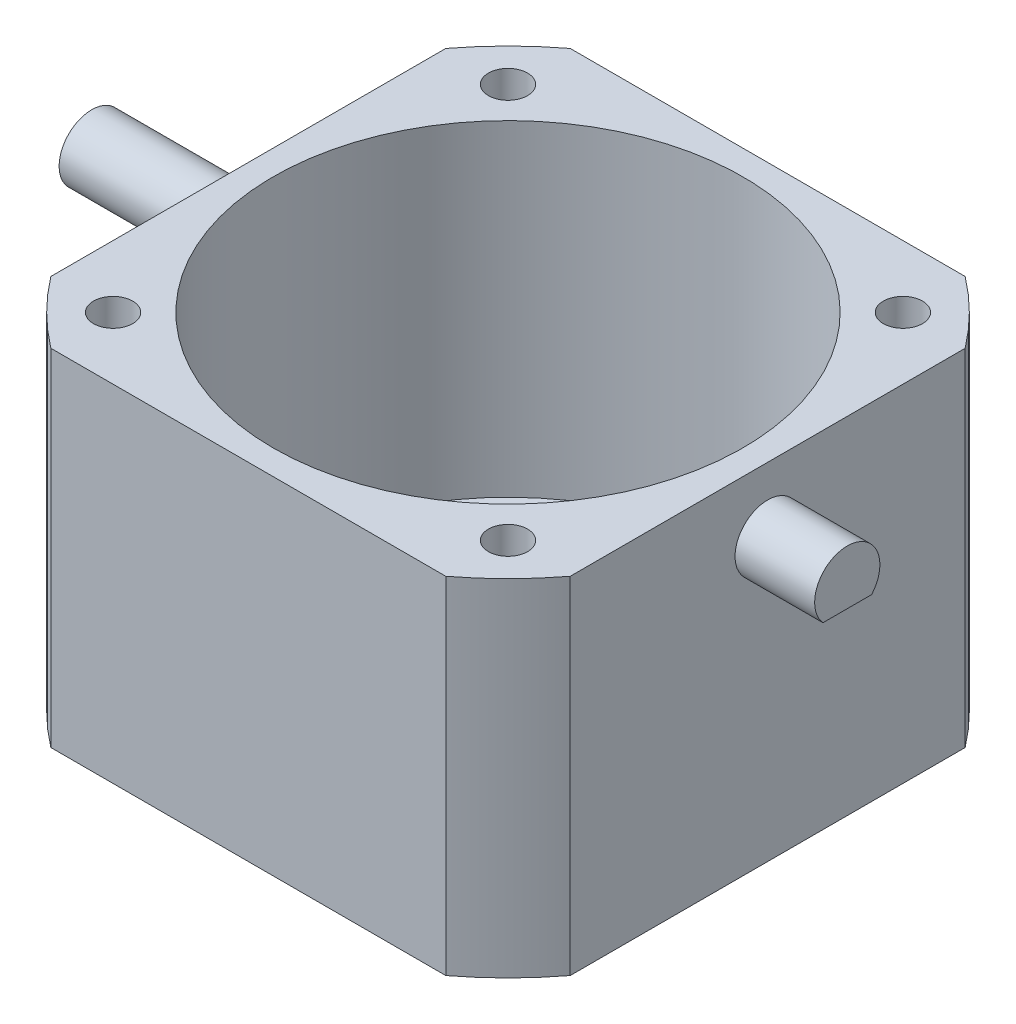
from build123d import *

# Parameters (mm, degrees)
SKETCH1_W                = 39.8
SKETCH1_H                = 39.8
BOSS_EXTRUDE1_DEPTH      = 40
CUT_EXTRUDE1_DEPTH       = 25
SKETCH3_R                = 6.5
CUT_EXTRUDE2_DEPTH       = 4.5
CUT_EXTRUDE3_DEPTH       = 64.547856
CUT_EXTRUDE3_DEPTH_BACK  = 64.547856
SKETCH4_R                = 1.585
CUT_EXTRUDE4_DEPTH       = 62.587986
CUT_EXTRUDE4_DEPTH_BACK  = 62.587986
SKETCH5_R                = 1.5
SKETCH6_R                = 2.5
BOSS_EXTRUDE2_DEPTH      = 12
BOSS_EXTRUDE3_START      = 5.1
SKETCH7_R                = 2.5
BOSS_EXTRUDE3_DEPTH      = 5.1
CUT_EXTRUDE5_DEPTH       = 73.111372
CUT_EXTRUDE6_DEPTH       = 73.111372
BOSS_EXTRUDE4_START      = 1
SKETCH10_R               = 2.5
BOSS_EXTRUDE4_DEPTH      = 1
SKETCH11_R               = 6.5
CUT_EXTRUDE7_DEPTH       = 68.535916
CUT_EXTRUDE8_START       = -12
CUT_EXTRUDE8_DEPTH       = 12
CUT_EXTRUDE9_START       = -3
SKETCH13_R               = 1.5
CUT_EXTRUDE9_DEPTH       = 3
BOSS_EXTRUDE5_DEPTH      = 1
CUT_EXTRUDE10_DEPTH      = 67.89432
CUT_EXTRUDE10_DEPTH_BACK = 67.89432
SKETCH15_R               = 1.5
CUT_EXTRUDE11_START      = -4
CUT_EXTRUDE11_DEPTH      = 4
CUT_EXTRUDE12_START      = -1
CUT_EXTRUDE12_DEPTH      = 1
BOSS_EXTRUDE6_DEPTH      = 3
BOSS_EXTRUDE7_START      = -3
BOSS_EXTRUDE7_OUTLINE_R  = 7
BOSS_EXTRUDE7_DEPTH      = 3
SKETCH20_R               = 1.5
CUT_EXTRUDE13_DEPTH      = 67.89432
CUT_EXTRUDE14_START      = -3
CUT_EXTRUDE14_DEPTH      = 3
CUT_EXTRUDE16_START      = -1.5
SKETCH22_R               = 17
SKETCH22_R_2             = 1.5
CUT_EXTRUDE16_DEPTH      = 1.5


# Read off the part's stored shape, not the designer's step: Cut-Extrude11, Boss-Extrude7, Cut-Extrude14
with BuildPart() as part:
    # Sketch1 → Boss-Extrude1 (new body)
    with BuildSketch(Plane(origin=(0, 0, 0), x_dir=(1, 0, 0), z_dir=(0, 1, 0))):
        with Locations((19.9, 19.9)):
            Rectangle(SKETCH1_W, SKETCH1_H)
    extrude(amount=BOSS_EXTRUDE1_DEPTH)

    # Sketch2 → Cut-Extrude1 (cut)
    with BuildSketch(Plane(origin=(0, 40, 0), x_dir=(1, 0, 0), z_dir=(0, 1, 0))):
        with BuildLine():
            ThreePointArc((37.9, 19.9), (32.627922, 32.627922), (19.9, 37.9))
            Line((19.9, 37.9), (19.9, 19.9))
            Line((19.9, 19.9), (37.9, 19.9))
        make_face()
        with BuildLine():
            Line((19.9, 19.9), (19.9, 37.9))
            ThreePointArc((19.9, 37.9), (7.172078, 32.627922), (1.9, 19.9))
            Line((1.9, 19.9), (19.9, 19.9))
        make_face()
        with BuildLine():
            Line((37.9, 19.9), (19.9, 19.9))
            Line((19.9, 19.9), (19.9, 1.9))
            ThreePointArc((19.9, 1.9), (32.627922, 7.172078), (37.9, 19.9))
        make_face()
        with BuildLine():
            Line((19.9, 1.9), (19.9, 19.9))
            Line((19.9, 19.9), (1.9, 19.9))
            ThreePointArc((1.9, 19.9), (7.172078, 7.172078), (19.9, 1.9))
        make_face()
        with BuildLine():
            ThreePointArc((37.9, 19.9), (32.627922, 32.627922), (19.9, 37.9))
            Line((19.9, 37.9), (19.9, 19.9))
            Line((19.9, 19.9), (37.9, 19.9))
        make_face()
        with BuildLine():
            Line((19.9, 19.9), (19.9, 37.9))
            ThreePointArc((19.9, 37.9), (7.172078, 32.627922), (1.9, 19.9))
            Line((1.9, 19.9), (19.9, 19.9))
        make_face()
        with BuildLine():
            Line((37.9, 19.9), (19.9, 19.9))
            Line((19.9, 19.9), (19.9, 1.9))
            ThreePointArc((19.9, 1.9), (32.627922, 7.172078), (37.9, 19.9))
        make_face()
        with BuildLine():
            Line((19.9, 1.9), (19.9, 19.9))
            Line((19.9, 19.9), (1.9, 19.9))
            ThreePointArc((1.9, 19.9), (7.172078, 7.172078), (19.9, 1.9))
        make_face()
        with BuildLine():
            ThreePointArc((37.9, 19.9), (32.627922, 32.627922), (19.9, 37.9))
            Line((19.9, 37.9), (19.9, 19.9))
            Line((19.9, 19.9), (37.9, 19.9))
        make_face()
        with BuildLine():
            Line((19.9, 19.9), (19.9, 37.9))
            ThreePointArc((19.9, 37.9), (7.172078, 32.627922), (1.9, 19.9))
            Line((1.9, 19.9), (19.9, 19.9))
        make_face()
        with BuildLine():
            Line((37.9, 19.9), (19.9, 19.9))
            Line((19.9, 19.9), (19.9, 1.9))
            ThreePointArc((19.9, 1.9), (32.627922, 7.172078), (37.9, 19.9))
        make_face()
        with BuildLine():
            Line((19.9, 1.9), (19.9, 19.9))
            Line((19.9, 19.9), (1.9, 19.9))
            ThreePointArc((1.9, 19.9), (7.172078, 7.172078), (19.9, 1.9))
        make_face()
        with BuildLine():
            ThreePointArc((37.9, 19.9), (32.627922, 32.627922), (19.9, 37.9))
            Line((19.9, 37.9), (19.9, 19.9))
            Line((19.9, 19.9), (37.9, 19.9))
        make_face()
        with BuildLine():
            Line((19.9, 19.9), (19.9, 37.9))
            ThreePointArc((19.9, 37.9), (7.172078, 32.627922), (1.9, 19.9))
            Line((1.9, 19.9), (19.9, 19.9))
        make_face()
        with BuildLine():
            Line((37.9, 19.9), (19.9, 19.9))
            Line((19.9, 19.9), (19.9, 1.9))
            ThreePointArc((19.9, 1.9), (32.627922, 7.172078), (37.9, 19.9))
        make_face()
        with BuildLine():
            Line((19.9, 1.9), (19.9, 19.9))
            Line((19.9, 19.9), (1.9, 19.9))
            ThreePointArc((1.9, 19.9), (7.172078, 7.172078), (19.9, 1.9))
        make_face()
    extrude(amount=-CUT_EXTRUDE1_DEPTH, mode=Mode.SUBTRACT)

    # Sketch3 → Cut-Extrude2 (cut)
    with BuildSketch(Plane(origin=(0, 15, 0), x_dir=(1, 0, 0), z_dir=(0, 1, 0))):
        with Locations(Location((19.9, 19.9, 0), (0, 0, 270))):
            Circle(SKETCH3_R)
    extrude(amount=-CUT_EXTRUDE2_DEPTH, mode=Mode.SUBTRACT)

    # Sketch4 → Cut-Extrude3 (cut, two sides: drawn at the far end of the back side and taken through both)
    with BuildSketch(Plane(origin=(0, 10.5, 0), x_dir=(1, 0, 0), z_dir=(0, 1, 0)).offset(-CUT_EXTRUDE3_DEPTH_BACK)):
        with Locations(Location((19.9, 19.9, 0), (0, 0, 270))):
            Circle(SKETCH4_R)
    extrude(amount=CUT_EXTRUDE3_DEPTH + CUT_EXTRUDE3_DEPTH_BACK, mode=Mode.SUBTRACT)

    # Sketch5 → Cut-Extrude4 (cut, two sides: drawn at the far end of the back side and taken through both)
    with BuildSketch(Plane(origin=(0, 15, 0), x_dir=(1, 0, 0), z_dir=(0, 1, 0)).offset(-CUT_EXTRUDE4_DEPTH_BACK)):
        with Locations(Location((7.4, 19.9, 0), (0, 0, 270))):
            Circle(SKETCH5_R)
        with Locations(Location((32.4, 19.9, 0), (0, 0, 270))):
            Circle(SKETCH5_R)
        with Locations(Location((19.9, 7.4, 0), (0, 0, 270))):
            Circle(SKETCH5_R)
        with Locations(Location((19.9, 32.4, 0), (0, 0, 270))):
            Circle(SKETCH5_R)
    extrude(amount=CUT_EXTRUDE4_DEPTH + CUT_EXTRUDE4_DEPTH_BACK, mode=Mode.SUBTRACT)

    # Sketch6 → Boss-Extrude2 (add)
    with BuildSketch(Plane.ZY):
        with Locations(Location((-19.9, 35, 0), (0, 0, 180))):
            Circle(SKETCH6_R)
    extrude(amount=BOSS_EXTRUDE2_DEPTH)

    # Sketch7 → Boss-Extrude3 (add)
    with BuildSketch(Plane(origin=(39.8, 0, 0), x_dir=(0, 0, -1), z_dir=(1, 0, 0)).offset(BOSS_EXTRUDE3_START)):
        with Locations((19.9, 35)):
            Circle(SKETCH7_R)
    extrude(amount=-BOSS_EXTRUDE3_DEPTH)

    # Sketch8 → Cut-Extrude5 (cut, through all)
    with BuildSketch(Plane(origin=(0, 40, 0), x_dir=(1, 0, 0), z_dir=(0, 1, 0))):
        with BuildLine():
            Line((39.8, 39.8), (35.032416, 39.8))
            ThreePointArc((35.032416, 39.8), (37.57767, 37.57767), (39.8, 35.032416))
            Line((39.8, 35.032416), (39.8, 39.8))
        make_face()
        with BuildLine():
            Line((4.767584, 39.8), (0, 39.8))
            Line((0, 39.8), (0, 35.032416))
            ThreePointArc((0, 35.032416), (2.22233, 37.57767), (4.767584, 39.8))
        make_face()
        with BuildLine():
            ThreePointArc((4.767584, 0), (2.22233, 2.22233), (0, 4.767584))
            Line((0, 4.767584), (0, 0))
            Line((0, 0), (4.767584, 0))
        make_face()
        with BuildLine():
            Line((39.8, 0), (39.8, 4.767584))
            ThreePointArc((39.8, 4.767584), (37.57767, 2.22233), (35.032416, 0))
            Line((35.032416, 0), (39.8, 0))
        make_face()
    extrude(amount=-CUT_EXTRUDE5_DEPTH, mode=Mode.SUBTRACT)

    # Sketch9 → Cut-Extrude6 (cut, through all)
    with BuildSketch(Plane(origin=(0, 40, 0), x_dir=(1, 0, 0), z_dir=(0, 1, 0))):
        with BuildLine():
            ThreePointArc((35.032416, 6.267584), (33.971755, 5.828245), (33.532416, 4.767584))
            Line((33.532416, 4.767584), (35.032416, 4.767584))
            Line((35.032416, 4.767584), (35.032416, 6.267584))
        make_face()
        with BuildLine():
            Line((35.032416, 4.767584), (33.532416, 4.767584))
            ThreePointArc((33.532416, 4.767584), (33.971755, 3.706924), (35.032416, 3.267584))
            Line((35.032416, 3.267584), (35.032416, 4.767584))
        make_face()
        with BuildLine():
            Line((35.032416, 6.267584), (35.032416, 4.767584))
            Line((35.032416, 4.767584), (36.532416, 4.767584))
            ThreePointArc((36.532416, 4.767584), (36.093076, 5.828245), (35.032416, 6.267584))
        make_face()
        with BuildLine():
            Line((36.532416, 4.767584), (35.032416, 4.767584))
            Line((35.032416, 4.767584), (35.032416, 3.267584))
            ThreePointArc((35.032416, 3.267584), (36.093076, 3.706924), (36.532416, 4.767584))
        make_face()
        with BuildLine():
            ThreePointArc((35.032416, 6.267584), (33.971755, 5.828245), (33.532416, 4.767584))
            Line((33.532416, 4.767584), (35.032416, 4.767584))
            Line((35.032416, 4.767584), (35.032416, 6.267584))
        make_face()
        with BuildLine():
            Line((35.032416, 4.767584), (33.532416, 4.767584))
            ThreePointArc((33.532416, 4.767584), (33.971755, 3.706924), (35.032416, 3.267584))
            Line((35.032416, 3.267584), (35.032416, 4.767584))
        make_face()
        with BuildLine():
            Line((35.032416, 6.267584), (35.032416, 4.767584))
            Line((35.032416, 4.767584), (36.532416, 4.767584))
            ThreePointArc((36.532416, 4.767584), (36.093076, 5.828245), (35.032416, 6.267584))
        make_face()
        with BuildLine():
            Line((36.532416, 4.767584), (35.032416, 4.767584))
            Line((35.032416, 4.767584), (35.032416, 3.267584))
            ThreePointArc((35.032416, 3.267584), (36.093076, 3.706924), (36.532416, 4.767584))
        make_face()
        with BuildLine():
            ThreePointArc((35.032416, 6.267584), (33.971755, 5.828245), (33.532416, 4.767584))
            Line((33.532416, 4.767584), (35.032416, 4.767584))
            Line((35.032416, 4.767584), (35.032416, 6.267584))
        make_face()
        with BuildLine():
            Line((35.032416, 4.767584), (33.532416, 4.767584))
            ThreePointArc((33.532416, 4.767584), (33.971755, 3.706924), (35.032416, 3.267584))
            Line((35.032416, 3.267584), (35.032416, 4.767584))
        make_face()
        with BuildLine():
            Line((35.032416, 6.267584), (35.032416, 4.767584))
            Line((35.032416, 4.767584), (36.532416, 4.767584))
            ThreePointArc((36.532416, 4.767584), (36.093076, 5.828245), (35.032416, 6.267584))
        make_face()
        with BuildLine():
            Line((36.532416, 4.767584), (35.032416, 4.767584))
            Line((35.032416, 4.767584), (35.032416, 3.267584))
            ThreePointArc((35.032416, 3.267584), (36.093076, 3.706924), (36.532416, 4.767584))
        make_face()
        with BuildLine():
            ThreePointArc((35.032416, 6.267584), (33.971755, 5.828245), (33.532416, 4.767584))
            Line((33.532416, 4.767584), (35.032416, 4.767584))
            Line((35.032416, 4.767584), (35.032416, 6.267584))
        make_face()
        with BuildLine():
            Line((35.032416, 4.767584), (33.532416, 4.767584))
            ThreePointArc((33.532416, 4.767584), (33.971755, 3.706924), (35.032416, 3.267584))
            Line((35.032416, 3.267584), (35.032416, 4.767584))
        make_face()
        with BuildLine():
            Line((35.032416, 6.267584), (35.032416, 4.767584))
            Line((35.032416, 4.767584), (36.532416, 4.767584))
            ThreePointArc((36.532416, 4.767584), (36.093076, 5.828245), (35.032416, 6.267584))
        make_face()
        with BuildLine():
            Line((36.532416, 4.767584), (35.032416, 4.767584))
            Line((35.032416, 4.767584), (35.032416, 3.267584))
            ThreePointArc((35.032416, 3.267584), (36.093076, 3.706924), (36.532416, 4.767584))
        make_face()
        with BuildLine():
            ThreePointArc((4.767584, 6.267584), (3.706924, 5.828245), (3.267584, 4.767584))
            Line((3.267584, 4.767584), (4.767584, 4.767584))
            Line((4.767584, 4.767584), (4.767584, 6.267584))
        make_face()
        with BuildLine():
            Line((4.767584, 4.767584), (3.267584, 4.767584))
            ThreePointArc((3.267584, 4.767584), (3.706924, 3.706924), (4.767584, 3.267584))
            Line((4.767584, 3.267584), (4.767584, 4.767584))
        make_face()
        with BuildLine():
            Line((4.767584, 6.267584), (4.767584, 4.767584))
            Line((4.767584, 4.767584), (6.267584, 4.767584))
            ThreePointArc((6.267584, 4.767584), (5.828245, 5.828245), (4.767584, 6.267584))
        make_face()
        with BuildLine():
            Line((6.267584, 4.767584), (4.767584, 4.767584))
            Line((4.767584, 4.767584), (4.767584, 3.267584))
            ThreePointArc((4.767584, 3.267584), (5.828245, 3.706924), (6.267584, 4.767584))
        make_face()
        with BuildLine():
            ThreePointArc((4.767584, 6.267584), (3.706924, 5.828245), (3.267584, 4.767584))
            Line((3.267584, 4.767584), (4.767584, 4.767584))
            Line((4.767584, 4.767584), (4.767584, 6.267584))
        make_face()
        with BuildLine():
            Line((4.767584, 4.767584), (3.267584, 4.767584))
            ThreePointArc((3.267584, 4.767584), (3.706924, 3.706924), (4.767584, 3.267584))
            Line((4.767584, 3.267584), (4.767584, 4.767584))
        make_face()
        with BuildLine():
            Line((4.767584, 6.267584), (4.767584, 4.767584))
            Line((4.767584, 4.767584), (6.267584, 4.767584))
            ThreePointArc((6.267584, 4.767584), (5.828245, 5.828245), (4.767584, 6.267584))
        make_face()
        with BuildLine():
            Line((6.267584, 4.767584), (4.767584, 4.767584))
            Line((4.767584, 4.767584), (4.767584, 3.267584))
            ThreePointArc((4.767584, 3.267584), (5.828245, 3.706924), (6.267584, 4.767584))
        make_face()
        with BuildLine():
            ThreePointArc((4.767584, 6.267584), (3.706924, 5.828245), (3.267584, 4.767584))
            Line((3.267584, 4.767584), (4.767584, 4.767584))
            Line((4.767584, 4.767584), (4.767584, 6.267584))
        make_face()
        with BuildLine():
            Line((4.767584, 4.767584), (3.267584, 4.767584))
            ThreePointArc((3.267584, 4.767584), (3.706924, 3.706924), (4.767584, 3.267584))
            Line((4.767584, 3.267584), (4.767584, 4.767584))
        make_face()
        with BuildLine():
            Line((4.767584, 6.267584), (4.767584, 4.767584))
            Line((4.767584, 4.767584), (6.267584, 4.767584))
            ThreePointArc((6.267584, 4.767584), (5.828245, 5.828245), (4.767584, 6.267584))
        make_face()
        with BuildLine():
            Line((6.267584, 4.767584), (4.767584, 4.767584))
            Line((4.767584, 4.767584), (4.767584, 3.267584))
            ThreePointArc((4.767584, 3.267584), (5.828245, 3.706924), (6.267584, 4.767584))
        make_face()
        with BuildLine():
            ThreePointArc((4.767584, 6.267584), (3.706924, 5.828245), (3.267584, 4.767584))
            Line((3.267584, 4.767584), (4.767584, 4.767584))
            Line((4.767584, 4.767584), (4.767584, 6.267584))
        make_face()
        with BuildLine():
            Line((4.767584, 4.767584), (3.267584, 4.767584))
            ThreePointArc((3.267584, 4.767584), (3.706924, 3.706924), (4.767584, 3.267584))
            Line((4.767584, 3.267584), (4.767584, 4.767584))
        make_face()
        with BuildLine():
            Line((4.767584, 6.267584), (4.767584, 4.767584))
            Line((4.767584, 4.767584), (6.267584, 4.767584))
            ThreePointArc((6.267584, 4.767584), (5.828245, 5.828245), (4.767584, 6.267584))
        make_face()
        with BuildLine():
            Line((6.267584, 4.767584), (4.767584, 4.767584))
            Line((4.767584, 4.767584), (4.767584, 3.267584))
            ThreePointArc((4.767584, 3.267584), (5.828245, 3.706924), (6.267584, 4.767584))
        make_face()
        with BuildLine():
            ThreePointArc((3.267584, 35.032416), (3.706924, 33.971755), (4.767584, 33.532416))
            Line((4.767584, 33.532416), (4.767584, 35.032416))
            Line((4.767584, 35.032416), (3.267584, 35.032416))
        make_face()
        with BuildLine():
            Line((4.767584, 35.032416), (4.767584, 33.532416))
            ThreePointArc((4.767584, 33.532416), (5.828245, 33.971755), (6.267584, 35.032416))
            Line((6.267584, 35.032416), (4.767584, 35.032416))
        make_face()
        with BuildLine():
            Line((3.267584, 35.032416), (4.767584, 35.032416))
            Line((4.767584, 35.032416), (4.767584, 36.532416))
            ThreePointArc((4.767584, 36.532416), (3.706924, 36.093076), (3.267584, 35.032416))
        make_face()
        with BuildLine():
            Line((4.767584, 36.532416), (4.767584, 35.032416))
            Line((4.767584, 35.032416), (6.267584, 35.032416))
            ThreePointArc((6.267584, 35.032416), (5.828245, 36.093076), (4.767584, 36.532416))
        make_face()
        with BuildLine():
            ThreePointArc((3.267584, 35.032416), (3.706924, 33.971755), (4.767584, 33.532416))
            Line((4.767584, 33.532416), (4.767584, 35.032416))
            Line((4.767584, 35.032416), (3.267584, 35.032416))
        make_face()
        with BuildLine():
            Line((4.767584, 35.032416), (4.767584, 33.532416))
            ThreePointArc((4.767584, 33.532416), (5.828245, 33.971755), (6.267584, 35.032416))
            Line((6.267584, 35.032416), (4.767584, 35.032416))
        make_face()
        with BuildLine():
            Line((3.267584, 35.032416), (4.767584, 35.032416))
            Line((4.767584, 35.032416), (4.767584, 36.532416))
            ThreePointArc((4.767584, 36.532416), (3.706924, 36.093076), (3.267584, 35.032416))
        make_face()
        with BuildLine():
            Line((4.767584, 36.532416), (4.767584, 35.032416))
            Line((4.767584, 35.032416), (6.267584, 35.032416))
            ThreePointArc((6.267584, 35.032416), (5.828245, 36.093076), (4.767584, 36.532416))
        make_face()
        with BuildLine():
            ThreePointArc((3.267584, 35.032416), (3.706924, 33.971755), (4.767584, 33.532416))
            Line((4.767584, 33.532416), (4.767584, 35.032416))
            Line((4.767584, 35.032416), (3.267584, 35.032416))
        make_face()
        with BuildLine():
            Line((4.767584, 35.032416), (4.767584, 33.532416))
            ThreePointArc((4.767584, 33.532416), (5.828245, 33.971755), (6.267584, 35.032416))
            Line((6.267584, 35.032416), (4.767584, 35.032416))
        make_face()
        with BuildLine():
            Line((3.267584, 35.032416), (4.767584, 35.032416))
            Line((4.767584, 35.032416), (4.767584, 36.532416))
            ThreePointArc((4.767584, 36.532416), (3.706924, 36.093076), (3.267584, 35.032416))
        make_face()
        with BuildLine():
            Line((4.767584, 36.532416), (4.767584, 35.032416))
            Line((4.767584, 35.032416), (6.267584, 35.032416))
            ThreePointArc((6.267584, 35.032416), (5.828245, 36.093076), (4.767584, 36.532416))
        make_face()
        with BuildLine():
            ThreePointArc((3.267584, 35.032416), (3.706924, 33.971755), (4.767584, 33.532416))
            Line((4.767584, 33.532416), (4.767584, 35.032416))
            Line((4.767584, 35.032416), (3.267584, 35.032416))
        make_face()
        with BuildLine():
            Line((4.767584, 35.032416), (4.767584, 33.532416))
            ThreePointArc((4.767584, 33.532416), (5.828245, 33.971755), (6.267584, 35.032416))
            Line((6.267584, 35.032416), (4.767584, 35.032416))
        make_face()
        with BuildLine():
            Line((3.267584, 35.032416), (4.767584, 35.032416))
            Line((4.767584, 35.032416), (4.767584, 36.532416))
            ThreePointArc((4.767584, 36.532416), (3.706924, 36.093076), (3.267584, 35.032416))
        make_face()
        with BuildLine():
            Line((4.767584, 36.532416), (4.767584, 35.032416))
            Line((4.767584, 35.032416), (6.267584, 35.032416))
            ThreePointArc((6.267584, 35.032416), (5.828245, 36.093076), (4.767584, 36.532416))
        make_face()
        with BuildLine():
            ThreePointArc((35.032416, 36.532416), (33.971755, 36.093076), (33.532416, 35.032416))
            Line((33.532416, 35.032416), (35.032416, 35.032416))
            Line((35.032416, 35.032416), (35.032416, 36.532416))
        make_face()
        with BuildLine():
            Line((35.032416, 35.032416), (33.532416, 35.032416))
            ThreePointArc((33.532416, 35.032416), (33.971755, 33.971755), (35.032416, 33.532416))
            Line((35.032416, 33.532416), (35.032416, 35.032416))
        make_face()
        with BuildLine():
            Line((35.032416, 35.032416), (35.032416, 33.532416))
            ThreePointArc((35.032416, 33.532416), (36.093076, 33.971755), (36.532416, 35.032416))
            Line((36.532416, 35.032416), (35.032416, 35.032416))
        make_face()
        with BuildLine():
            Line((35.032416, 36.532416), (35.032416, 35.032416))
            Line((35.032416, 35.032416), (36.532416, 35.032416))
            ThreePointArc((36.532416, 35.032416), (36.093076, 36.093076), (35.032416, 36.532416))
        make_face()
        with BuildLine():
            ThreePointArc((35.032416, 36.532416), (33.971755, 36.093076), (33.532416, 35.032416))
            Line((33.532416, 35.032416), (35.032416, 35.032416))
            Line((35.032416, 35.032416), (35.032416, 36.532416))
        make_face()
        with BuildLine():
            Line((35.032416, 35.032416), (33.532416, 35.032416))
            ThreePointArc((33.532416, 35.032416), (33.971755, 33.971755), (35.032416, 33.532416))
            Line((35.032416, 33.532416), (35.032416, 35.032416))
        make_face()
        with BuildLine():
            Line((35.032416, 35.032416), (35.032416, 33.532416))
            ThreePointArc((35.032416, 33.532416), (36.093076, 33.971755), (36.532416, 35.032416))
            Line((36.532416, 35.032416), (35.032416, 35.032416))
        make_face()
        with BuildLine():
            Line((35.032416, 36.532416), (35.032416, 35.032416))
            Line((35.032416, 35.032416), (36.532416, 35.032416))
            ThreePointArc((36.532416, 35.032416), (36.093076, 36.093076), (35.032416, 36.532416))
        make_face()
        with BuildLine():
            ThreePointArc((35.032416, 36.532416), (33.971755, 36.093076), (33.532416, 35.032416))
            Line((33.532416, 35.032416), (35.032416, 35.032416))
            Line((35.032416, 35.032416), (35.032416, 36.532416))
        make_face()
        with BuildLine():
            Line((35.032416, 35.032416), (33.532416, 35.032416))
            ThreePointArc((33.532416, 35.032416), (33.971755, 33.971755), (35.032416, 33.532416))
            Line((35.032416, 33.532416), (35.032416, 35.032416))
        make_face()
        with BuildLine():
            Line((35.032416, 35.032416), (35.032416, 33.532416))
            ThreePointArc((35.032416, 33.532416), (36.093076, 33.971755), (36.532416, 35.032416))
            Line((36.532416, 35.032416), (35.032416, 35.032416))
        make_face()
        with BuildLine():
            Line((35.032416, 36.532416), (35.032416, 35.032416))
            Line((35.032416, 35.032416), (36.532416, 35.032416))
            ThreePointArc((36.532416, 35.032416), (36.093076, 36.093076), (35.032416, 36.532416))
        make_face()
        with BuildLine():
            ThreePointArc((35.032416, 36.532416), (33.971755, 36.093076), (33.532416, 35.032416))
            Line((33.532416, 35.032416), (35.032416, 35.032416))
            Line((35.032416, 35.032416), (35.032416, 36.532416))
        make_face()
        with BuildLine():
            Line((35.032416, 35.032416), (33.532416, 35.032416))
            ThreePointArc((33.532416, 35.032416), (33.971755, 33.971755), (35.032416, 33.532416))
            Line((35.032416, 33.532416), (35.032416, 35.032416))
        make_face()
        with BuildLine():
            Line((35.032416, 35.032416), (35.032416, 33.532416))
            ThreePointArc((35.032416, 33.532416), (36.093076, 33.971755), (36.532416, 35.032416))
            Line((36.532416, 35.032416), (35.032416, 35.032416))
        make_face()
        with BuildLine():
            Line((35.032416, 36.532416), (35.032416, 35.032416))
            Line((35.032416, 35.032416), (36.532416, 35.032416))
            ThreePointArc((36.532416, 35.032416), (36.093076, 36.093076), (35.032416, 36.532416))
        make_face()
    extrude(amount=-CUT_EXTRUDE6_DEPTH, mode=Mode.SUBTRACT)

    # Sketch10 → Boss-Extrude4 (add)
    with BuildSketch(Plane(origin=(44.9, 0, 0), x_dir=(0, 0, -1), z_dir=(1, 0, 0)).offset(BOSS_EXTRUDE4_START)):
        with Locations((19.9, 35)):
            Circle(SKETCH10_R)
    extrude(amount=-BOSS_EXTRUDE4_DEPTH)

    # Sketch11 → Cut-Extrude7 (cut, through all)
    with BuildSketch(Plane(origin=(0, 10.5, 0), x_dir=(1, 0, 0), z_dir=(0, 1, 0))):
        with Locations(Location((19.9, 19.9, 0), (0, 0, 270))):
            Circle(SKETCH11_R)
    extrude(amount=-CUT_EXTRUDE7_DEPTH, mode=Mode.SUBTRACT)

    # Sketch12 → Cut-Extrude8 (cut)
    with BuildSketch(Plane.XZ.offset(CUT_EXTRUDE8_START)):
        with BuildLine():
            Line((0, -4.767584), (0, -35.032416))
            ThreePointArc((0, -35.032416), (2.22233, -37.57767), (4.767584, -39.8))
            Line((4.767584, -39.8), (35.032416, -39.8))
            ThreePointArc((35.032416, -39.8), (37.57767, -37.57767), (39.8, -35.032416))
            Line((39.8, -35.032416), (39.8, -4.767584))
            ThreePointArc((39.8, -4.767584), (37.57767, -2.22233), (35.032416, 0))
            Line((35.032416, 0), (4.767584, 0))
            ThreePointArc((4.767584, 0), (2.22233, -2.22233), (0, -4.767584))
        make_face()
    extrude(amount=CUT_EXTRUDE8_DEPTH, mode=Mode.SUBTRACT)

    # Sketch13 → Cut-Extrude9 (cut)
    # profile 1 of 2: a face of its own
    with BuildSketch(Plane.XZ.offset(-12).offset(CUT_EXTRUDE9_START)):
        with BuildLine():
            ThreePointArc((19.9, -26.4), (24.142641, -28.157359), (25.9, -32.4))
            Line((25.9, -32.4), (25.9, -39.8))
            Line((25.9, -39.8), (35.032416, -39.8))
            ThreePointArc((35.032416, -39.8), (37.57767, -37.57767), (39.8, -35.032416))
            Line((39.8, -35.032416), (39.8, -4.767584))
            ThreePointArc((39.8, -4.767584), (37.57767, -2.22233), (35.032416, 0))
            Line((35.032416, 0), (25.9, 0))
            Line((25.9, 0), (25.9, -7.4))
            ThreePointArc((25.9, -7.4), (24.142641, -11.642641), (19.9, -13.4))
            ThreePointArc((19.9, -13.4), (24.496194, -15.303806), (26.4, -19.9))
            ThreePointArc((26.4, -19.9), (24.496194, -24.496194), (19.9, -26.4))
        make_face()
        with Locations(Location((35.032416, -35.032416, 0), (0, 0, 90))):
            Circle(SKETCH13_R, mode=Mode.SUBTRACT)
        with Locations((32.4, -19.9)):
            Circle(SKETCH13_R, mode=Mode.SUBTRACT)
        with Locations(Location((35.032416, -4.767584, 0), (0, 0, 90))):
            Circle(SKETCH13_R, mode=Mode.SUBTRACT)
    # profile 2 of 2: a face of its own
    with BuildSketch(Plane.XZ.offset(-12).offset(CUT_EXTRUDE9_START)):
        with BuildLine():
            Line((13.9, -39.8), (13.9, -32.4))
            ThreePointArc((13.9, -32.4), (15.657359, -28.157359), (19.9, -26.4))
            ThreePointArc((19.9, -26.4), (13.4, -19.9), (19.9, -13.4))
            ThreePointArc((19.9, -13.4), (15.657359, -11.642641), (13.9, -7.4))
            Line((13.9, -7.4), (13.9, 0))
            Line((13.9, 0), (4.767584, 0))
            ThreePointArc((4.767584, 0), (2.22233, -2.22233), (0, -4.767584))
            Line((0, -4.767584), (0, -35.032416))
            ThreePointArc((0, -35.032416), (2.22233, -37.57767), (4.767584, -39.8))
            Line((4.767584, -39.8), (13.9, -39.8))
        make_face()
        with Locations(Location((4.767584, -35.032416, 0), (0, 0, 90))):
            Circle(SKETCH13_R, mode=Mode.SUBTRACT)
        with Locations((7.4, -19.9)):
            Circle(SKETCH13_R, mode=Mode.SUBTRACT)
        with Locations(Location((4.767584, -4.767584, 0), (0, 0, 90))):
            Circle(SKETCH13_R, mode=Mode.SUBTRACT)
    extrude(amount=CUT_EXTRUDE9_DEPTH, mode=Mode.SUBTRACT)

    # Sketch14 → Boss-Extrude5 (add)
    with BuildSketch(Plane.XZ.offset(-12)):
        with BuildLine():
            Line((13.9, -32.4), (13.9, -39.8))
            Line((13.9, -39.8), (25.9, -39.8))
            Line((25.9, -39.8), (25.9, -32.4))
            ThreePointArc((25.9, -32.4), (19.9, -26.4), (13.9, -32.4))
        make_face()
        with BuildLine():
            Line((25.9, 0), (13.9, 0))
            Line((13.9, 0), (13.9, -7.4))
            ThreePointArc((13.9, -7.4), (19.9, -13.4), (25.9, -7.4))
            Line((25.9, -7.4), (25.9, 0))
        make_face()
    extrude(amount=BOSS_EXTRUDE5_DEPTH)

    # Sketch15 → Cut-Extrude10 (cut, two sides: drawn at the far end of the back side and taken through both)
    with BuildSketch(Plane(origin=(0, 12, 0), x_dir=(1, 0, 0), z_dir=(0, 1, 0)).offset(-CUT_EXTRUDE10_DEPTH_BACK)):
        with Locations(Location((19.9, 7.4, 0), (0, 0, 270))):
            Circle(SKETCH15_R)
        with Locations(Location((19.9, 32.4, 0), (0, 0, 270))):
            Circle(SKETCH15_R)
    extrude(amount=CUT_EXTRUDE10_DEPTH + CUT_EXTRUDE10_DEPTH_BACK, mode=Mode.SUBTRACT)

    # Cut-Extrude11 outline → Cut-Extrude11 (cut)
    with BuildSketch(Plane.XZ.offset(-11).offset(CUT_EXTRUDE11_START)):
        with BuildLine():
            Line((23.216625, -12.4), (16.583375, -12.4))
            ThreePointArc((16.583375, -12.4), (19.9, -13.4), (23.216625, -12.4))
        make_face()
        with BuildLine():
            ThreePointArc((23.216625, -27.4), (19.9, -26.4), (16.583375, -27.4))
            Line((16.583375, -27.4), (23.216625, -27.4))
        make_face()
    extrude(amount=CUT_EXTRUDE11_DEPTH, mode=Mode.SUBTRACT)

    # Sketch17 → Cut-Extrude12 (cut)
    with BuildSketch(Plane.XZ.offset(-11).offset(CUT_EXTRUDE12_START)):
        with BuildLine():
            Line((23.216625, -27.4), (16.583375, -27.4))
            ThreePointArc((16.583375, -27.4), (14.613236, -29.562726), (13.9, -32.4))
            Line((13.9, -32.4), (13.9, -39.8))
            Line((13.9, -39.8), (25.9, -39.8))
            Line((25.9, -39.8), (25.9, -32.4))
            ThreePointArc((25.9, -32.4), (25.186764, -29.562726), (23.216625, -27.4))
        make_face()
        with BuildLine():
            Line((16.583375, -12.4), (23.216625, -12.4))
            ThreePointArc((23.216625, -12.4), (25.186764, -10.237274), (25.9, -7.4))
            Line((25.9, -7.4), (25.9, 0))
            Line((25.9, 0), (13.9, 0))
            Line((13.9, 0), (13.9, -7.4))
            ThreePointArc((13.9, -7.4), (14.613236, -10.237274), (16.583375, -12.4))
        make_face()
    extrude(amount=CUT_EXTRUDE12_DEPTH, mode=Mode.SUBTRACT)

    # Sketch18 → Boss-Extrude6 (add)
    with BuildSketch(Plane.XZ.offset(-15)):
        with BuildLine():
            Line((13.9, -2.929437), (13.9, 0))
            Line((13.9, 0), (4.767584, 0))
            ThreePointArc((4.767584, 0), (2.22233, -2.22233), (0, -4.767584))
            Line((0, -4.767584), (0, -35.032416))
            ThreePointArc((0, -35.032416), (2.22233, -37.57767), (4.767584, -39.8))
            Line((4.767584, -39.8), (13.9, -39.8))
            Line((13.9, -39.8), (13.9, -36.870563))
            ThreePointArc((13.9, -36.870563), (1.9, -19.9), (13.9, -2.929437))
        make_face()
        with BuildLine():
            Line((25.9, -36.870563), (25.9, -39.8))
            Line((25.9, -39.8), (35.032416, -39.8))
            ThreePointArc((35.032416, -39.8), (37.57767, -37.57767), (39.8, -35.032416))
            Line((39.8, -35.032416), (39.8, -4.767584))
            ThreePointArc((39.8, -4.767584), (37.57767, -2.22233), (35.032416, 0))
            Line((35.032416, 0), (25.9, 0))
            Line((25.9, 0), (25.9, -2.929437))
            ThreePointArc((25.9, -2.929437), (37.9, -19.9), (25.9, -36.870563))
        make_face()
    extrude(amount=BOSS_EXTRUDE6_DEPTH)

    # Boss-Extrude7 outline → Boss-Extrude7 (add)
    with BuildSketch(Plane.XZ.offset(-12).offset(BOSS_EXTRUDE7_START)):
        with BuildLine():
            Line((25.9, -2.929437), (25.9, -7.4))
            ThreePointArc((25.9, -7.4), (25.186764, -10.237274), (23.216625, -12.4))
            Line((23.216625, -12.4), (16.583375, -12.4))
            ThreePointArc((16.583375, -12.4), (14.613236, -10.237274), (13.9, -7.4))
            Line((13.9, -7.4), (13.9, -2.929437))
            ThreePointArc((13.9, -2.929437), (1.9, -19.9), (13.9, -36.870563))
            Line((13.9, -36.870563), (13.9, -32.4))
            ThreePointArc((13.9, -32.4), (14.613236, -29.562726), (16.583375, -27.4))
            Line((16.583375, -27.4), (23.216625, -27.4))
            ThreePointArc((23.216625, -27.4), (25.186764, -29.562726), (25.9, -32.4))
            Line((25.9, -32.4), (25.9, -36.870563))
            ThreePointArc((25.9, -36.870563), (37.9, -19.9), (25.9, -2.929437))
        make_face()
        with Locations((19.9, -19.9)):
            Circle(BOSS_EXTRUDE7_OUTLINE_R, mode=Mode.SUBTRACT)
    extrude(amount=BOSS_EXTRUDE7_DEPTH)

    # Sketch20 → Cut-Extrude13 (cut, through all)
    with BuildSketch(Plane(origin=(0, 40, 0), x_dir=(1, 0, 0), z_dir=(0, 1, 0))):
        with Locations(Location((4.767584, 35.032416, 0), (0, 0, 270))):
            Circle(SKETCH20_R)
        with Locations(Location((35.032416, 4.767584, 0), (0, 0, 270))):
            Circle(SKETCH20_R)
        with Locations(Location((35.032416, 35.032416, 0), (0, 0, 270))):
            Circle(SKETCH20_R)
        with Locations(Location((4.767584, 4.767584, 0), (0, 0, 270))):
            Circle(SKETCH20_R)
    extrude(amount=-CUT_EXTRUDE13_DEPTH, mode=Mode.SUBTRACT)

    # Cut-Extrude14 outline → Cut-Extrude14 (cut)
    with BuildSketch(Plane(origin=(45.9, 0, 0), x_dir=(0, 0, -1), z_dir=(1, 0, 0)).offset(CUT_EXTRUDE14_START)):
        with BuildLine():
            Line((21.76339, 33.333333), (18.03661, 33.333333))
            ThreePointArc((18.03661, 33.333333), (19.9, 32.5), (21.76339, 33.333333))
        make_face()
    extrude(amount=CUT_EXTRUDE14_DEPTH, mode=Mode.SUBTRACT)

    # Sketch22 → Cut-Extrude16 (cut)
    with BuildSketch(Plane.XZ.offset(-12).offset(CUT_EXTRUDE16_START)):
        with BuildLine():
            ThreePointArc((0, -35.032416), (2.22233, -37.57767), (4.767584, -39.8))
            Line((4.767584, -39.8), (35.032416, -39.8))
            ThreePointArc((35.032416, -39.8), (37.57767, -37.57767), (39.8, -35.032416))
            Line((39.8, -35.032416), (39.8, -4.767584))
            ThreePointArc((39.8, -4.767584), (37.57767, -2.22233), (35.032416, 0))
            Line((35.032416, 0), (4.767584, 0))
            ThreePointArc((4.767584, 0), (2.22233, -2.22233), (0, -4.767584))
            Line((0, -4.767584), (0, -35.032416))
        make_face()
        with Locations(Location((19.9, -19.9, 0), (0, 0, 270))):
            Circle(SKETCH22_R, mode=Mode.SUBTRACT)
        with Locations(Location((35.032416, -35.032416, 0), (0, 0, 90))):
            Circle(SKETCH22_R_2, mode=Mode.SUBTRACT)
        with Locations(Location((4.767584, -35.032416, 0), (0, 0, 90))):
            Circle(SKETCH22_R_2, mode=Mode.SUBTRACT)
        with Locations(Location((35.032416, -4.767584, 0), (0, 0, 90))):
            Circle(SKETCH22_R_2, mode=Mode.SUBTRACT)
        with Locations(Location((4.767584, -4.767584, 0), (0, 0, 90))):
            Circle(SKETCH22_R_2, mode=Mode.SUBTRACT)
    extrude(amount=CUT_EXTRUDE16_DEPTH, mode=Mode.SUBTRACT)


solid = part.part
